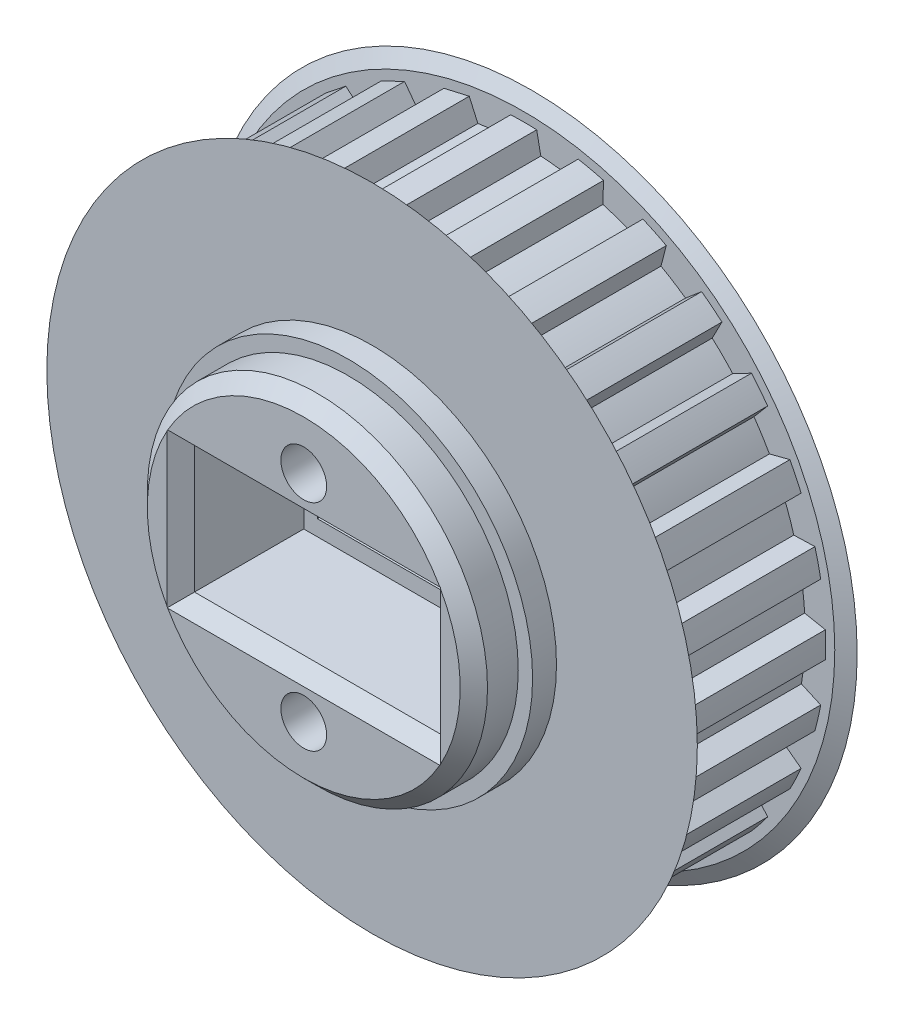
from build123d import *

# Parameters (mm, degrees)
CROQUIS1_R                 = 1.5
SALIENTE_EXTRUIR1_DEPTH    = 10.5
CROQUIS2_R                 = 24.5
CROQUIS2_R_2               = 1.5
SALIENTE_EXTRUIR2_DEPTH    = 0.6
SALIENTE_EXTRUIR4_START    = 4.25
CROQUIS4_R                 = 12.45
CROQUIS4_R_2               = 1.5
SALIENTE_EXTRUIR4_DEPTH    = 4.25
SALIENTE_EXTRUIR6_START    = 0.6
CROQUIS6_R                 = 24.5
CROQUIS6_R_2               = 1.5
SALIENTE_EXTRUIR6_DEPTH    = 0.6
SALIENTE_EXTRUIR5_START    = 1.75
CROQUIS5_R                 = 13.5
CROQUIS5_R_2               = 1.5
SALIENTE_EXTRUIR5_DEPTH    = 1.75
CHAFL_N2_SIZE              = 1.732050808
CHAFL_N2_SIZE_2            = 1
CROQUIS3_R                 = 12.45
CROQUIS3_R_2               = 1.5
SALIENTE_EXTRUIR7_DEPTH    = 5
CHAFL_N4_SIZE              = 1
CROQUIS7_R                 = 13.5
CROQUIS7_R_2               = 1.5
SALIENTE_EXTRUIR8_DEPTH    = 1.75
CORTAR_EXTRUIR1_DEPTH      = 38.319882212
CORTAR_EXTRUIR1_DEPTH_BACK = 38.319882212
CROQUIS8_R                 = 1.675
CROQUIS8_W                 = 16
CROQUIS8_H                 = 7
CROQUIS10_W                = 18
CROQUIS10_H                = 9.3
CORTAR_EXTRUIR3_DEPTH      = 9
CHAFL_N5_SIZE              = 1
SKETCH1_R                  = 12.45
SKETCH1_R_2                = 1.675
BOSS_EXTRUDE1_DEPTH        = 5
SKETCH2_R                  = 1.45
CUT_EXTRUDE1_DEPTH         = 40.340641941
SKETCH4_W                  = 8
SKETCH4_H                  = 7
CUT_EXTRUDE2_DEPTH         = 21
CHAMFER3_SIZE              = 1
CHAMFER2_SIZE              = 0.75


# Some blends are built 0.0001 mm under size
with BuildPart() as part:
    # Croquis1 → Saliente-Extruir1 (new body)
    with BuildSketch(Plane.XY):
        with BuildLine():
            Line((-0.95, 22.079572007), (-1.25, 20.562040268))
            ThreePointArc((-1.25, 20.562040268), (-2.306468208, 20.470471524), (-3.356824514, 20.324658157))
            Line((-3.356824514, 20.324658157), (-3.986985468, 21.737385926))
            Line((-3.986985468, 21.737385926), (-5.839348501, 21.314596151))
            Line((-5.839348501, 21.314596151), (-5.794144295, 19.768355822))
            ThreePointArc((-5.794144295, 19.768355822), (-6.803748676, 19.443996604), (-7.795323831, 19.068112816))
            Line((-7.795323831, 19.068112816), (-8.724046836, 20.305196547))
            Line((-8.724046836, 20.305196547), (-10.435887685, 19.480817443))
            Line((-10.435887685, 19.480817443), (-10.047746, 17.983403469))
            ThreePointArc((-10.047746, 17.983403469), (-10.959860776, 17.442518504), (-11.84293306, 16.855412678))
            Line((-11.84293306, 16.855412678), (-13.023648067, 17.854819826))
            Line((-13.023648067, 17.854819826), (-14.509127884, 16.670189203))
            Line((-14.509127884, 16.670189203), (-13.797511766, 15.296688173))
            ThreePointArc((-13.797511766, 15.296688173), (-14.566399692, 14.566399692), (-15.296688173, 13.797511766))
            Line((-15.296688173, 13.797511766), (-16.670189203, 14.509127884))
            ThreePointArc((-16.670189203, 14.509127884), (-17.278475763, 13.779124621), (-17.854819826, 13.023648067))
            Line((-17.854819826, 13.023648067), (-16.855412678, 11.84293306))
            ThreePointArc((-16.855412678, 11.84293306), (-17.442518504, 10.959860776), (-17.983403469, 10.047746))
            Line((-17.983403469, 10.047746), (-19.480817443, 10.435887685))
            ThreePointArc((-19.480817443, 10.435887685), (-19.911411981, 9.588830634), (-20.305196547, 8.724046836))
            Line((-20.305196547, 8.724046836), (-19.068112816, 7.795323831))
            ThreePointArc((-19.068112816, 7.795323831), (-19.443996604, 6.803748676), (-19.768355822, 5.794144295))
            Line((-19.768355822, 5.794144295), (-21.314596151, 5.839348501))
            ThreePointArc((-21.314596151, 5.839348501), (-21.545906859, 4.91771264), (-21.737385926, 3.986985468))
            Line((-21.737385926, 3.986985468), (-20.324658157, 3.356824514))
            ThreePointArc((-20.324658157, 3.356824514), (-20.470471524, 2.306468208), (-20.562040268, 1.25))
            Line((-20.562040268, 1.25), (-22.079572007, 0.95))
            ThreePointArc((-22.079572007, 0.95), (-22.1, 0), (-22.079572007, -0.95))
            Line((-22.079572007, -0.95), (-20.562040268, -1.25))
            ThreePointArc((-20.562040268, -1.25), (-20.470471524, -2.306468208), (-20.324658157, -3.356824514))
            Line((-20.324658157, -3.356824514), (-21.737385926, -3.986985468))
            ThreePointArc((-21.737385926, -3.986985468), (-21.545906859, -4.91771264), (-21.314596151, -5.839348501))
            Line((-21.314596151, -5.839348501), (-19.768355822, -5.794144295))
            ThreePointArc((-19.768355822, -5.794144295), (-19.443996604, -6.803748676), (-19.068112816, -7.795323831))
            Line((-19.068112816, -7.795323831), (-20.305196547, -8.724046836))
            ThreePointArc((-20.305196547, -8.724046836), (-19.911411981, -9.588830634), (-19.480817443, -10.435887685))
            Line((-19.480817443, -10.435887685), (-17.983403469, -10.047746))
            ThreePointArc((-17.983403469, -10.047746), (-17.442518504, -10.959860776), (-16.855412678, -11.84293306))
            Line((-16.855412678, -11.84293306), (-17.854819826, -13.023648067))
            ThreePointArc((-17.854819826, -13.023648067), (-17.278475763, -13.779124621), (-16.670189203, -14.509127884))
            Line((-16.670189203, -14.509127884), (-15.296688173, -13.797511766))
            ThreePointArc((-15.296688173, -13.797511766), (-14.566399692, -14.566399692), (-13.797511766, -15.296688173))
            Line((-13.797511766, -15.296688173), (-14.509127884, -16.670189203))
            ThreePointArc((-14.509127884, -16.670189203), (-13.779124621, -17.278475763), (-13.023648067, -17.854819826))
            Line((-13.023648067, -17.854819826), (-11.84293306, -16.855412678))
            ThreePointArc((-11.84293306, -16.855412678), (-10.959860776, -17.442518504), (-10.047746, -17.983403469))
            Line((-10.047746, -17.983403469), (-10.435887685, -19.480817443))
            ThreePointArc((-10.435887685, -19.480817443), (-9.588830634, -19.911411981), (-8.724046836, -20.305196547))
            Line((-8.724046836, -20.305196547), (-7.795323831, -19.068112816))
            ThreePointArc((-7.795323831, -19.068112816), (-6.803748676, -19.443996604), (-5.794144295, -19.768355822))
            Line((-5.794144295, -19.768355822), (-5.839348501, -21.314596151))
            ThreePointArc((-5.839348501, -21.314596151), (-4.91771264, -21.545906859), (-3.986985468, -21.737385926))
            Line((-3.986985468, -21.737385926), (-3.356824514, -20.324658157))
            ThreePointArc((-3.356824514, -20.324658157), (-2.306468208, -20.470471524), (-1.25, -20.562040268))
            Line((-1.25, -20.562040268), (-0.95, -22.079572007))
            ThreePointArc((-0.95, -22.079572007), (0, -22.1), (0.95, -22.079572007))
            Line((0.95, -22.079572007), (1.25, -20.562040268))
            ThreePointArc((1.25, -20.562040268), (2.306468208, -20.470471524), (3.356824514, -20.324658157))
            Line((3.356824514, -20.324658157), (3.986985468, -21.737385926))
            ThreePointArc((3.986985468, -21.737385926), (4.91771264, -21.545906859), (5.839348501, -21.314596151))
            Line((5.839348501, -21.314596151), (5.794144295, -19.768355822))
            ThreePointArc((5.794144295, -19.768355822), (6.803748676, -19.443996604), (7.795323831, -19.068112816))
            Line((7.795323831, -19.068112816), (8.724046836, -20.305196547))
            ThreePointArc((8.724046836, -20.305196547), (9.588830634, -19.911411981), (10.435887685, -19.480817443))
            Line((10.435887685, -19.480817443), (10.047746, -17.983403469))
            ThreePointArc((10.047746, -17.983403469), (10.959860776, -17.442518504), (11.84293306, -16.855412678))
            Line((11.84293306, -16.855412678), (13.023648067, -17.854819826))
            ThreePointArc((13.023648067, -17.854819826), (13.779124621, -17.278475763), (14.509127884, -16.670189203))
            Line((14.509127884, -16.670189203), (13.797511766, -15.296688173))
            ThreePointArc((13.797511766, -15.296688173), (14.566399692, -14.566399692), (15.296688173, -13.797511766))
            Line((15.296688173, -13.797511766), (16.670189203, -14.509127884))
            ThreePointArc((16.670189203, -14.509127884), (17.278475763, -13.779124621), (17.854819826, -13.023648067))
            Line((17.854819826, -13.023648067), (16.855412678, -11.84293306))
            ThreePointArc((16.855412678, -11.84293306), (17.442518504, -10.959860776), (17.983403469, -10.047746))
            Line((17.983403469, -10.047746), (19.480817443, -10.435887685))
            ThreePointArc((19.480817443, -10.435887685), (19.911411981, -9.588830634), (20.305196547, -8.724046836))
            Line((20.305196547, -8.724046836), (19.068112816, -7.795323831))
            ThreePointArc((19.068112816, -7.795323831), (19.443996604, -6.803748676), (19.768355822, -5.794144295))
            Line((19.768355822, -5.794144295), (21.314596151, -5.839348501))
            ThreePointArc((21.314596151, -5.839348501), (21.545906859, -4.91771264), (21.737385926, -3.986985468))
            Line((21.737385926, -3.986985468), (20.324658157, -3.356824514))
            ThreePointArc((20.324658157, -3.356824514), (20.470471524, -2.306468208), (20.562040268, -1.25))
            Line((20.562040268, -1.25), (22.079572007, -0.95))
            ThreePointArc((22.079572007, -0.95), (22.1, 0), (22.079572007, 0.95))
            Line((22.079572007, 0.95), (20.562040268, 1.25))
            ThreePointArc((20.562040268, 1.25), (20.470471524, 2.306468208), (20.324658157, 3.356824514))
            Line((20.324658157, 3.356824514), (21.737385926, 3.986985468))
            ThreePointArc((21.737385926, 3.986985468), (21.545906859, 4.91771264), (21.314596151, 5.839348501))
            Line((21.314596151, 5.839348501), (19.768355822, 5.794144295))
            ThreePointArc((19.768355822, 5.794144295), (19.443996604, 6.803748676), (19.068112816, 7.795323831))
            Line((19.068112816, 7.795323831), (20.305196547, 8.724046836))
            ThreePointArc((20.305196547, 8.724046836), (19.911411981, 9.588830634), (19.480817443, 10.435887685))
            Line((19.480817443, 10.435887685), (17.983403469, 10.047746))
            ThreePointArc((17.983403469, 10.047746), (17.442518504, 10.959860776), (16.855412678, 11.84293306))
            Line((16.855412678, 11.84293306), (17.854819826, 13.023648067))
            ThreePointArc((17.854819826, 13.023648067), (17.278475763, 13.779124621), (16.670189203, 14.509127884))
            Line((16.670189203, 14.509127884), (15.296688173, 13.797511766))
            ThreePointArc((15.296688173, 13.797511766), (14.566399692, 14.566399692), (13.797511766, 15.296688173))
            Line((13.797511766, 15.296688173), (14.509127884, 16.670189203))
            ThreePointArc((14.509127884, 16.670189203), (13.779124621, 17.278475763), (13.023648067, 17.854819826))
            Line((13.023648067, 17.854819826), (11.84293306, 16.855412678))
            ThreePointArc((11.84293306, 16.855412678), (10.959860776, 17.442518504), (10.047746, 17.983403469))
            Line((10.047746, 17.983403469), (10.435887685, 19.480817443))
            ThreePointArc((10.435887685, 19.480817443), (9.588830634, 19.911411981), (8.724046836, 20.305196547))
            Line((8.724046836, 20.305196547), (7.795323831, 19.068112816))
            ThreePointArc((7.795323831, 19.068112816), (6.803748676, 19.443996604), (5.794144295, 19.768355822))
            Line((5.794144295, 19.768355822), (5.839348501, 21.314596151))
            ThreePointArc((5.839348501, 21.314596151), (4.91771264, 21.545906859), (3.986985468, 21.737385926))
            Line((3.986985468, 21.737385926), (3.356824514, 20.324658157))
            ThreePointArc((3.356824514, 20.324658157), (2.306468208, 20.470471524), (1.25, 20.562040268))
            Line((1.25, 20.562040268), (0.95, 22.079572007))
            ThreePointArc((0.95, 22.079572007), (0, 22.1), (-0.95, 22.079572007))
        make_face()
        with Locations(Location((0, 0, 0), (0, 0, 180))):
            Circle(CROQUIS1_R, mode=Mode.SUBTRACT)
    extrude(amount=SALIENTE_EXTRUIR1_DEPTH)

    # Croquis2 → Saliente-Extruir2 (add)
    with BuildSketch(Plane.XY.offset(10.5)):
        Circle(CROQUIS2_R)
        with Locations(Location((0, 0, 0), (0, 0, 180))):
            Circle(CROQUIS2_R_2, mode=Mode.SUBTRACT)
    extrude(amount=SALIENTE_EXTRUIR2_DEPTH)

    # Croquis4 → Saliente-Extruir4 (add)
    with BuildSketch(Plane(origin=(0, 0, 0), x_dir=(-1, 0, 0), z_dir=(0, 0, -1)).offset(SALIENTE_EXTRUIR4_START)):
        with Locations(Location((0, 0, 0), (0, 0, 180))):
            Circle(CROQUIS4_R)
        Circle(CROQUIS4_R_2, mode=Mode.SUBTRACT)
    extrude(amount=-SALIENTE_EXTRUIR4_DEPTH)

    # Croquis6 → Saliente-Extruir6 (add)
    with BuildSketch(Plane(origin=(0, 0, 0), x_dir=(-1, 0, 0), z_dir=(0, 0, -1)).offset(SALIENTE_EXTRUIR6_START)):
        with Locations(Location((0, 0, 0), (0, 0, 180))):
            Circle(CROQUIS6_R)
        Circle(CROQUIS6_R_2, mode=Mode.SUBTRACT)
    extrude(amount=-SALIENTE_EXTRUIR6_DEPTH)

    # Croquis5 → Saliente-Extruir5 (add)
    with BuildSketch(Plane(origin=(0, 0, -0.6), x_dir=(-1, 0, 0), z_dir=(0, 0, -1)).offset(SALIENTE_EXTRUIR5_START)):
        Circle(CROQUIS5_R)
        Circle(CROQUIS5_R_2, mode=Mode.SUBTRACT)
    extrude(amount=-SALIENTE_EXTRUIR5_DEPTH)

    # Chaflán2
    # the kernel refuses this chamfer: 1.732050808, 1 mm, written as the material it takes off along each edge
    with BuildSketch(Plane(origin=(0, 0, 0), x_dir=(1, 0, 0), z_dir=(0, 1, 0))) as chafl_n2_piece_1:
        Polygon((24.5 - CHAFL_N2_SIZE, 0), (24.5, CHAFL_N2_SIZE_2), (24.5, 0), align=None)
    revolve(axis=Axis((0, 0, 0), (0, 0, -1)), mode=Mode.SUBTRACT)
    with BuildSketch(Plane(origin=(0, 0, 10.5), x_dir=(1, 0, 0), z_dir=(0, -1, 0))) as chafl_n2_piece_2:
        Polygon((24.5 - CHAFL_N2_SIZE, 0), (24.5, CHAFL_N2_SIZE_2), (24.5, 0), align=None)
    revolve(axis=Axis((0, 0, 10.5), (0, 0, 1)), mode=Mode.SUBTRACT)

    # Croquis3 → Saliente-Extruir7 (add)
    with BuildSketch(Plane.XY.offset(11.1)):
        with Locations(Location((0, 0, 0), (0, 0, 180))):
            Circle(CROQUIS3_R)
        with Locations(Location((0, 0, 0), (0, 0, 180))):
            Circle(CROQUIS3_R_2, mode=Mode.SUBTRACT)
    extrude(amount=SALIENTE_EXTRUIR7_DEPTH)

    # Chaflán4
    chafl_n4_edges = [part.edges().sort_by_distance(p)[0] for p in [
        (12.45, 0, 16.1),
    ]]
    chamfer(chafl_n4_edges, length=CHAFL_N4_SIZE)

    # Croquis7 → Saliente-Extruir8 (add)
    with BuildSketch(Plane.XY.offset(11.1)):
        with Locations(Location((0, 0, 0), (0, 0, 180))):
            Circle(CROQUIS7_R)
        with Locations(Location((0, 0, 0), (0, 0, 180))):
            Circle(CROQUIS7_R_2, mode=Mode.SUBTRACT)
    extrude(amount=SALIENTE_EXTRUIR8_DEPTH)

    # Croquis8 → Cortar-Extruir1 (cut, two sides: drawn at the far end of the back side and taken through both)
    with BuildSketch(Plane.XY.offset(-CORTAR_EXTRUIR1_DEPTH_BACK)):
        with Locations((0, 7.875631857)):
            Circle(CROQUIS8_R)
        with Locations((0, -7.875631857)):
            Circle(CROQUIS8_R)
        Rectangle(CROQUIS8_W, CROQUIS8_H)
    extrude(amount=CORTAR_EXTRUIR1_DEPTH + CORTAR_EXTRUIR1_DEPTH_BACK, mode=Mode.SUBTRACT)

    # Croquis10 → Cortar-Extruir3 (cut)
    with BuildSketch(Plane.XY.offset(16.1)):
        Rectangle(CROQUIS10_W, CROQUIS10_H)
    extrude(amount=-CORTAR_EXTRUIR3_DEPTH, mode=Mode.SUBTRACT)

    # Chaflán5
    # the kernel refuses this chamfer: 1 mm, written as the material it takes off along each edge
    with BuildSketch(Plane(origin=(8, 3.5, -4.25), x_dir=(0.9996219169112968, 0, -0.02749587661058651), z_dir=(0, -1, 0)), Plane(origin=(-8, -3.5, -4.25), x_dir=(-0.9996219169112968, 0, -0.02749587661058651), z_dir=(0, 1, 0))) as chafl_n5_piece_1:
        Polygon((CHAFL_N5_SIZE * 0.999621916911, CHAFL_N5_SIZE * 0.0274958766106), (-CHAFL_N5_SIZE * 0.0274958766106, CHAFL_N5_SIZE * 0.999621916911), (0, 0), align=None)
    extrude(amount=7, mode=Mode.SUBTRACT)
    with BuildSketch(Plane(origin=(8, -3.5, -4.25), x_dir=(0, -0.9996219169112968, -0.027495876610586497), z_dir=(-1, 0, 0)), Plane(origin=(-8, 3.5, -4.25), x_dir=(0, 0.9996219169112968, -0.027495876610586487), z_dir=(1, 0, 0))) as chafl_n5_piece_2:
        Polygon((CHAFL_N5_SIZE * 0.999621916911, CHAFL_N5_SIZE * 0.0274958766106), (-CHAFL_N5_SIZE * 0.0274958766106, CHAFL_N5_SIZE * 0.999621916911), (0, 0), align=None)
    extrude(amount=16, mode=Mode.SUBTRACT)
    with BuildSketch(Plane(origin=(-9, 4.65, 16.1), x_dir=(-0.9996219169112968, 0, 0.027495876610585647), z_dir=(0, -1, 0)), Plane(origin=(9, -4.65, 16.1), x_dir=(0.9996219169112968, 0, 0.027495876610585647), z_dir=(0, 1, 0))) as chafl_n5_piece_3:
        Polygon((CHAFL_N5_SIZE * 0.999621916911, CHAFL_N5_SIZE * 0.0274958766106), (-CHAFL_N5_SIZE * 0.0274958766106, CHAFL_N5_SIZE * 0.999621916911), (0, 0), align=None)
    extrude(amount=9.3, mode=Mode.SUBTRACT)
    with BuildSketch(Plane(origin=(-9, -4.65, 16.1), x_dir=(0, -0.9996219169112968, 0.027495876610585623), z_dir=(1, 0, 0)), Plane(origin=(9, 4.65, 16.1), x_dir=(0, 0.9996219169112968, 0.027495876610585623), z_dir=(-1, 0, 0))) as chafl_n5_piece_4:
        Polygon((CHAFL_N5_SIZE * 0.999621916911, CHAFL_N5_SIZE * 0.0274958766106), (-CHAFL_N5_SIZE * 0.0274958766106, CHAFL_N5_SIZE * 0.999621916911), (0, 0), align=None)
    extrude(amount=18, mode=Mode.SUBTRACT)
    with BuildSketch(Plane(origin=(-8, 3.5, -4.25), x_dir=(0, 0.9996219169112968, -0.027495876610586487), z_dir=(1, 0, 0))) as chafl_n5_piece_5a_section:
        Polygon((CHAFL_N5_SIZE * 0.999621916911, CHAFL_N5_SIZE * 0.0274958766106), (-CHAFL_N5_SIZE * 0.0274958766106, CHAFL_N5_SIZE * 0.999621916911), (0, 0), align=None)
    chafl_n5_piece_5a = extrude(amount=18.571682988, mode=Mode.PRIVATE)
    chafl_n5_piece_5a = split(chafl_n5_piece_5a, bisect_by=Plane(origin=(8, 3.829793627, -3.920206373), z_dir=(1, 0, 0)), keep=Keep.TOP, mode=Mode.PRIVATE)
    with BuildSketch(Plane(origin=(8, 6.071682988, -4.25), x_dir=(0.9996219169112968, 0, -0.02749587661058651), z_dir=(0, -1, 0))) as chafl_n5_piece_5b_section:
        Polygon((CHAFL_N5_SIZE * 0.999621916911, CHAFL_N5_SIZE * 0.0274958766106), (-CHAFL_N5_SIZE * 0.0274958766106, CHAFL_N5_SIZE * 0.999621916911), (0, 0), align=None)
    chafl_n5_piece_5b = extrude(amount=9.571682988, mode=Mode.PRIVATE)
    chafl_n5_piece_5b = split(chafl_n5_piece_5b, bisect_by=Plane(origin=(8.329793627, 3.5, -3.920206373), z_dir=(0, 1, 0)), keep=Keep.TOP, mode=Mode.PRIVATE)
    chafl_n5_piece_5 = chafl_n5_piece_5a & chafl_n5_piece_5b
    add(chafl_n5_piece_5, mode=Mode.SUBTRACT)
    with BuildSketch(Plane(origin=(8, 3.5, -4.25), x_dir=(0.9996219169112968, 0, -0.02749587661058651), z_dir=(0, -1, 0))) as chafl_n5_piece_6a_section:
        Polygon((CHAFL_N5_SIZE * 0.999621916911, CHAFL_N5_SIZE * 0.0274958766106), (-CHAFL_N5_SIZE * 0.0274958766106, CHAFL_N5_SIZE * 0.999621916911), (0, 0), align=None)
    chafl_n5_piece_6a = extrude(amount=9.571682988, mode=Mode.PRIVATE)
    chafl_n5_piece_6a = split(chafl_n5_piece_6a, bisect_by=Plane(origin=(8.329793627, -3.5, -3.920206373), z_dir=(0, -1, 0)), keep=Keep.TOP, mode=Mode.PRIVATE)
    with BuildSketch(Plane(origin=(10.571682988, -3.5, -4.25), x_dir=(0, -0.9996219169112968, -0.027495876610586497), z_dir=(-1, 0, 0))) as chafl_n5_piece_6b_section:
        Polygon((CHAFL_N5_SIZE * 0.999621916911, CHAFL_N5_SIZE * 0.0274958766106), (-CHAFL_N5_SIZE * 0.0274958766106, CHAFL_N5_SIZE * 0.999621916911), (0, 0), align=None)
    chafl_n5_piece_6b = extrude(amount=18.571682988, mode=Mode.PRIVATE)
    chafl_n5_piece_6b = split(chafl_n5_piece_6b, bisect_by=Plane(origin=(8, -3.829793627, -3.920206373), z_dir=(1, 0, 0)), keep=Keep.TOP, mode=Mode.PRIVATE)
    chafl_n5_piece_6 = chafl_n5_piece_6a & chafl_n5_piece_6b
    add(chafl_n5_piece_6, mode=Mode.SUBTRACT)
    with BuildSketch(Plane(origin=(8, -3.5, -4.25), x_dir=(0, -0.9996219169112968, -0.027495876610586497), z_dir=(-1, 0, 0))) as chafl_n5_piece_7a_section:
        Polygon((CHAFL_N5_SIZE * 0.999621916911, CHAFL_N5_SIZE * 0.0274958766106), (-CHAFL_N5_SIZE * 0.0274958766106, CHAFL_N5_SIZE * 0.999621916911), (0, 0), align=None)
    chafl_n5_piece_7a = extrude(amount=18.571682988, mode=Mode.PRIVATE)
    chafl_n5_piece_7a = split(chafl_n5_piece_7a, bisect_by=Plane(origin=(-8, -3.829793627, -3.920206373), z_dir=(-1, 0, 0)), keep=Keep.TOP, mode=Mode.PRIVATE)
    with BuildSketch(Plane(origin=(-8, -6.071682988, -4.25), x_dir=(-0.9996219169112968, 0, -0.02749587661058651), z_dir=(0, 1, 0))) as chafl_n5_piece_7b_section:
        Polygon((CHAFL_N5_SIZE * 0.999621916911, CHAFL_N5_SIZE * 0.0274958766106), (-CHAFL_N5_SIZE * 0.0274958766106, CHAFL_N5_SIZE * 0.999621916911), (0, 0), align=None)
    chafl_n5_piece_7b = extrude(amount=9.571682988, mode=Mode.PRIVATE)
    chafl_n5_piece_7b = split(chafl_n5_piece_7b, bisect_by=Plane(origin=(-8.329793627, -3.5, -3.920206373), z_dir=(0, -1, 0)), keep=Keep.TOP, mode=Mode.PRIVATE)
    chafl_n5_piece_7 = chafl_n5_piece_7a & chafl_n5_piece_7b
    add(chafl_n5_piece_7, mode=Mode.SUBTRACT)
    with BuildSketch(Plane(origin=(-10.571682988, 3.5, -4.25), x_dir=(0, 0.9996219169112968, -0.027495876610586487), z_dir=(1, 0, 0))) as chafl_n5_piece_8a_section:
        Polygon((CHAFL_N5_SIZE * 0.999621916911, CHAFL_N5_SIZE * 0.0274958766106), (-CHAFL_N5_SIZE * 0.0274958766106, CHAFL_N5_SIZE * 0.999621916911), (0, 0), align=None)
    chafl_n5_piece_8a = extrude(amount=18.571682988, mode=Mode.PRIVATE)
    chafl_n5_piece_8a = split(chafl_n5_piece_8a, bisect_by=Plane(origin=(-8, 3.829793627, -3.920206373), z_dir=(-1, 0, 0)), keep=Keep.TOP, mode=Mode.PRIVATE)
    with BuildSketch(Plane(origin=(-8, -3.5, -4.25), x_dir=(-0.9996219169112968, 0, -0.02749587661058651), z_dir=(0, 1, 0))) as chafl_n5_piece_8b_section:
        Polygon((CHAFL_N5_SIZE * 0.999621916911, CHAFL_N5_SIZE * 0.0274958766106), (-CHAFL_N5_SIZE * 0.0274958766106, CHAFL_N5_SIZE * 0.999621916911), (0, 0), align=None)
    chafl_n5_piece_8b = extrude(amount=9.571682988, mode=Mode.PRIVATE)
    chafl_n5_piece_8b = split(chafl_n5_piece_8b, bisect_by=Plane(origin=(-8.329793627, 3.5, -3.920206373), z_dir=(0, 1, 0)), keep=Keep.TOP, mode=Mode.PRIVATE)
    chafl_n5_piece_8 = chafl_n5_piece_8a & chafl_n5_piece_8b
    add(chafl_n5_piece_8, mode=Mode.SUBTRACT)
    with BuildSketch(Plane(origin=(9, 4.65, 16.1), x_dir=(0, 0.9996219169112968, 0.027495876610585623), z_dir=(-1, 0, 0))) as chafl_n5_piece_9a_section:
        Polygon((CHAFL_N5_SIZE * 0.999621916911, CHAFL_N5_SIZE * 0.0274958766106), (-CHAFL_N5_SIZE * 0.0274958766106, CHAFL_N5_SIZE * 0.999621916911), (0, 0), align=None)
    chafl_n5_piece_9a = extrude(amount=20.571682988, mode=Mode.PRIVATE)
    chafl_n5_piece_9a = split(chafl_n5_piece_9a, bisect_by=Plane(origin=(-9, 4.979793627, 15.770206373), z_dir=(-1, 0, 0)), keep=Keep.TOP, mode=Mode.PRIVATE)
    with BuildSketch(Plane(origin=(-9, 7.221682988, 16.1), x_dir=(-0.9996219169112968, 0, 0.027495876610585647), z_dir=(0, -1, 0))) as chafl_n5_piece_9b_section:
        Polygon((CHAFL_N5_SIZE * 0.999621916911, CHAFL_N5_SIZE * 0.0274958766106), (-CHAFL_N5_SIZE * 0.0274958766106, CHAFL_N5_SIZE * 0.999621916911), (0, 0), align=None)
    chafl_n5_piece_9b = extrude(amount=11.871682988, mode=Mode.PRIVATE)
    chafl_n5_piece_9b = split(chafl_n5_piece_9b, bisect_by=Plane(origin=(-9.329793627, 4.65, 15.770206373), z_dir=(0, 1, 0)), keep=Keep.TOP, mode=Mode.PRIVATE)
    chafl_n5_piece_9 = chafl_n5_piece_9a & chafl_n5_piece_9b
    add(chafl_n5_piece_9, mode=Mode.SUBTRACT)
    with BuildSketch(Plane(origin=(-9, 4.65, 16.1), x_dir=(-0.9996219169112968, 0, 0.027495876610585647), z_dir=(0, -1, 0))) as chafl_n5_piece_10a_section:
        Polygon((CHAFL_N5_SIZE * 0.999621916911, CHAFL_N5_SIZE * 0.0274958766106), (-CHAFL_N5_SIZE * 0.0274958766106, CHAFL_N5_SIZE * 0.999621916911), (0, 0), align=None)
    chafl_n5_piece_10a = extrude(amount=11.871682988, mode=Mode.PRIVATE)
    chafl_n5_piece_10a = split(chafl_n5_piece_10a, bisect_by=Plane(origin=(-9.329793627, -4.65, 15.770206373), z_dir=(0, -1, 0)), keep=Keep.TOP, mode=Mode.PRIVATE)
    with BuildSketch(Plane(origin=(-11.571682988, -4.65, 16.1), x_dir=(0, -0.9996219169112968, 0.027495876610585623), z_dir=(1, 0, 0))) as chafl_n5_piece_10b_section:
        Polygon((CHAFL_N5_SIZE * 0.999621916911, CHAFL_N5_SIZE * 0.0274958766106), (-CHAFL_N5_SIZE * 0.0274958766106, CHAFL_N5_SIZE * 0.999621916911), (0, 0), align=None)
    chafl_n5_piece_10b = extrude(amount=20.571682988, mode=Mode.PRIVATE)
    chafl_n5_piece_10b = split(chafl_n5_piece_10b, bisect_by=Plane(origin=(-9, -4.979793627, 15.770206373), z_dir=(-1, 0, 0)), keep=Keep.TOP, mode=Mode.PRIVATE)
    chafl_n5_piece_10 = chafl_n5_piece_10a & chafl_n5_piece_10b
    add(chafl_n5_piece_10, mode=Mode.SUBTRACT)
    with BuildSketch(Plane(origin=(-9, -4.65, 16.1), x_dir=(0, -0.9996219169112968, 0.027495876610585623), z_dir=(1, 0, 0))) as chafl_n5_piece_11a_section:
        Polygon((CHAFL_N5_SIZE * 0.999621916911, CHAFL_N5_SIZE * 0.0274958766106), (-CHAFL_N5_SIZE * 0.0274958766106, CHAFL_N5_SIZE * 0.999621916911), (0, 0), align=None)
    chafl_n5_piece_11a = extrude(amount=20.571682988, mode=Mode.PRIVATE)
    chafl_n5_piece_11a = split(chafl_n5_piece_11a, bisect_by=Plane(origin=(9, -4.979793627, 15.770206373), z_dir=(1, 0, 0)), keep=Keep.TOP, mode=Mode.PRIVATE)
    with BuildSketch(Plane(origin=(9, -7.221682988, 16.1), x_dir=(0.9996219169112968, 0, 0.027495876610585647), z_dir=(0, 1, 0))) as chafl_n5_piece_11b_section:
        Polygon((CHAFL_N5_SIZE * 0.999621916911, CHAFL_N5_SIZE * 0.0274958766106), (-CHAFL_N5_SIZE * 0.0274958766106, CHAFL_N5_SIZE * 0.999621916911), (0, 0), align=None)
    chafl_n5_piece_11b = extrude(amount=11.871682988, mode=Mode.PRIVATE)
    chafl_n5_piece_11b = split(chafl_n5_piece_11b, bisect_by=Plane(origin=(9.329793627, -4.65, 15.770206373), z_dir=(0, -1, 0)), keep=Keep.TOP, mode=Mode.PRIVATE)
    chafl_n5_piece_11 = chafl_n5_piece_11a & chafl_n5_piece_11b
    add(chafl_n5_piece_11, mode=Mode.SUBTRACT)
    with BuildSketch(Plane(origin=(11.571682988, 4.65, 16.1), x_dir=(0, 0.9996219169112968, 0.027495876610585623), z_dir=(-1, 0, 0))) as chafl_n5_piece_12a_section:
        Polygon((CHAFL_N5_SIZE * 0.999621916911, CHAFL_N5_SIZE * 0.0274958766106), (-CHAFL_N5_SIZE * 0.0274958766106, CHAFL_N5_SIZE * 0.999621916911), (0, 0), align=None)
    chafl_n5_piece_12a = extrude(amount=20.571682988, mode=Mode.PRIVATE)
    chafl_n5_piece_12a = split(chafl_n5_piece_12a, bisect_by=Plane(origin=(9, 4.979793627, 15.770206373), z_dir=(1, 0, 0)), keep=Keep.TOP, mode=Mode.PRIVATE)
    with BuildSketch(Plane(origin=(9, -4.65, 16.1), x_dir=(0.9996219169112968, 0, 0.027495876610585647), z_dir=(0, 1, 0))) as chafl_n5_piece_12b_section:
        Polygon((CHAFL_N5_SIZE * 0.999621916911, CHAFL_N5_SIZE * 0.0274958766106), (-CHAFL_N5_SIZE * 0.0274958766106, CHAFL_N5_SIZE * 0.999621916911), (0, 0), align=None)
    chafl_n5_piece_12b = extrude(amount=11.871682988, mode=Mode.PRIVATE)
    chafl_n5_piece_12b = split(chafl_n5_piece_12b, bisect_by=Plane(origin=(9.329793627, 4.65, 15.770206373), z_dir=(0, 1, 0)), keep=Keep.TOP, mode=Mode.PRIVATE)
    chafl_n5_piece_12 = chafl_n5_piece_12a & chafl_n5_piece_12b
    add(chafl_n5_piece_12, mode=Mode.SUBTRACT)

    # Sketch1 → Boss-Extrude1 (add)
    with BuildSketch(Plane(origin=(0, 0, -4.25), x_dir=(-1, 0, 0), z_dir=(0, 0, -1))):
        Circle(SKETCH1_R)
        with Locations(Location((0, 7.875631857, 0), (0, 0, 180))):
            Circle(SKETCH1_R_2, mode=Mode.SUBTRACT)
        with Locations(Location((0, -7.875631857, 0), (0, 0, 180))):
            Circle(SKETCH1_R_2, mode=Mode.SUBTRACT)
    extrude(amount=-BOSS_EXTRUDE1_DEPTH)

    # Sketch2 → Cut-Extrude1 (cut, through all)
    with BuildSketch(Plane(origin=(0, 0, -4.25), x_dir=(-1, 0, 0), z_dir=(0, 0, -1))):
        with Locations((-7.5, 0)):
            Circle(SKETCH2_R)
        with Locations(Location((7.5, 0, 0), (0, 0, 69.828728654))):
            Circle(SKETCH2_R)
    extrude(amount=-CUT_EXTRUDE1_DEPTH, mode=Mode.SUBTRACT)

    # Sketch4 → Cut-Extrude2 (cut)
    with BuildSketch(Plane.XY.offset(16.1)):
        Rectangle(SKETCH4_W, SKETCH4_H)
    extrude(amount=-CUT_EXTRUDE2_DEPTH, mode=Mode.SUBTRACT)

    # Chamfer3
    chamfer3_edges = [part.edges().sort_by_distance(p)[0] for p in [
        (-4, 0, -4.25),
        (0, 3.5, -4.25),
        (4, 0, -4.25),
        (0, -3.5, -4.25),
    ]]
    chamfer(chamfer3_edges, length=CHAMFER3_SIZE - 0.0001)  # a hair under: the kernel refuses the full size

    # Chamfer2
    chamfer2_edges = [part.edges().sort_by_distance(p)[0] for p in [
        (-12.45, 0, -4.25),
    ]]
    chamfer(chamfer2_edges, length=CHAMFER2_SIZE)


solid = part.part
